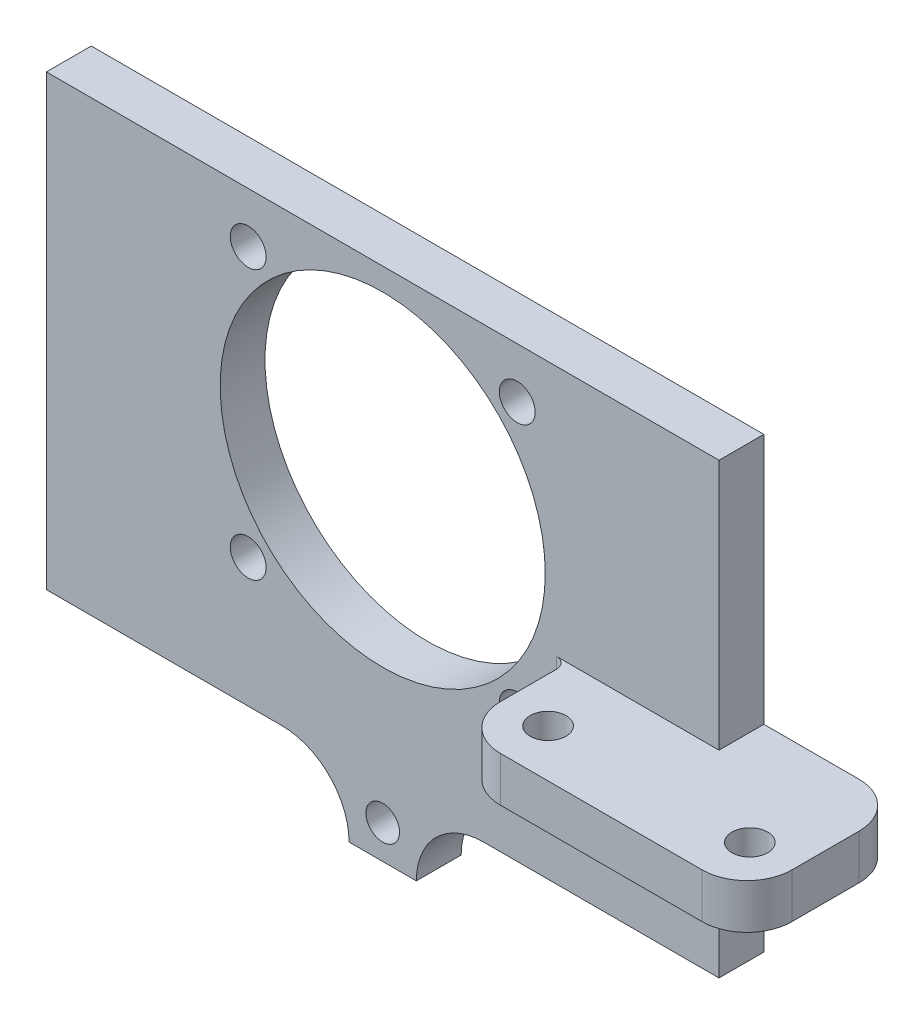
from build123d import *

# Parameters (mm, degrees)
SKETCH1_W                = 60
SKETCH1_H                = 40
BOSS_EXTRUDE1_DEPTH      = 4
SKETCH4_R                = 14.5
CUT_EXTRUDE1_DEPTH       = 4
SKETCH6_R                = 1.6
CUT_EXTRUDE2_DEPTH       = 4
SKETCH7_W                = 26
SKETCH7_H                = 4
BOSS_EXTRUDE3_DEPTH      = 10
SKETCH8_R                = 1.6
CUT_EXTRUDE3_DEPTH       = 78.162231694
SKETCH9_W                = 4
SKETCH9_H                = 4
BOSS_EXTRUDE4_DEPTH      = 12.5
FILLET2_R                = 4
FILLET3_R                = 1
SKETCH10_W               = 6
SKETCH10_H               = 4
BOSS_EXTRUDE5_DEPTH      = 6
FILLET4_R                = 6
F_3_0_3_DIAMETER_HOLE1_D = 3


with BuildPart() as part:
    # Sketch1 → Boss-Extrude1 (new body)
    with BuildSketch(Plane.XY):
        with Locations((30, 20)):
            Rectangle(SKETCH1_W, SKETCH1_H)
    extrude(amount=BOSS_EXTRUDE1_DEPTH)

    # Sketch4 → Cut-Extrude1 (cut)
    with BuildSketch(Plane.XY.offset(4)):
        with Locations((30, 23.5)):
            Circle(SKETCH4_R)
    extrude(amount=-CUT_EXTRUDE1_DEPTH, mode=Mode.SUBTRACT)

    # Sketch6 → Cut-Extrude2 (cut)
    with BuildSketch(Plane.XY.offset(4)):
        with Locations((42, 11.5)):
            Circle(SKETCH6_R)
        with Locations((18, 11.5)):
            Circle(SKETCH6_R)
        with Locations((18, 35.5)):
            Circle(SKETCH6_R)
        with Locations((42, 35.5)):
            Circle(SKETCH6_R)
    extrude(amount=-CUT_EXTRUDE2_DEPTH, mode=Mode.SUBTRACT)

    # Sketch7 → Boss-Extrude3 (add)
    with BuildSketch(Plane.XY.offset(4)):
        with Locations((59.5, 15.6)):
            Rectangle(SKETCH7_W, SKETCH7_H)
    extrude(amount=BOSS_EXTRUDE3_DEPTH)

    # Sketch8 → Cut-Extrude3 (cut, through all)
    with BuildSketch(Plane(origin=(0, 17.6, 0), x_dir=(1, 0, 0), z_dir=(0, 1, 0))):
        with Locations(Location((68.5, -9.75, 0), (0, 0, 270))):
            Circle(SKETCH8_R)
        with Locations(Location((50.5, -9.75, 0), (0, 0, 270))):
            Circle(SKETCH8_R)
    extrude(amount=-CUT_EXTRUDE3_DEPTH, mode=Mode.SUBTRACT)

    # Sketch9 → Boss-Extrude4 (add)
    with BuildSketch(Plane(origin=(60, 0, 0), x_dir=(0, 0, -1), z_dir=(1, 0, 0))):
        with Locations((-2, 15.6)):
            Rectangle(SKETCH9_W, SKETCH9_H)
    extrude(amount=BOSS_EXTRUDE4_DEPTH)

    # Fillet2
    fillet2_edges = [part.edges().sort_by_distance(p)[0] for p in [
        (46.5, 15.6, 14),
        (72.5, 15.6, 14),
        (72.5, 15.6, 0),
    ]]
    fillet(fillet2_edges, radius=FILLET2_R)

    # Fillet3
    fillet3_edges = [part.edges().sort_by_distance(p)[0] for p in [
        (46.5, 15.6, 4),
        (53.25, 13.6, 4),
        (60, 13.6, 2),
    ]]
    fillet(fillet3_edges, radius=FILLET3_R)

    # Sketch10 → Boss-Extrude5 (add)
    with BuildSketch(Plane.XZ):
        with Locations((30, 2)):
            Rectangle(SKETCH10_W, SKETCH10_H)
    extrude(amount=BOSS_EXTRUDE5_DEPTH)

    # Fillet4
    fillet4_edges = [part.edges().sort_by_distance(p)[0] for p in [
        (27, 0, 2),
        (33, 0, 2),
    ]]
    fillet(fillet4_edges, radius=FILLET4_R - 0.0001)  # a hair under: the kernel refuses the full size

    # Ø3.0 (3) Diameter Hole1 (through all)
    with Locations(Plane.XY.offset(4)):
        with Locations((30, -3)):
            Hole(F_3_0_3_DIAMETER_HOLE1_D / 2)


solid = part.part
